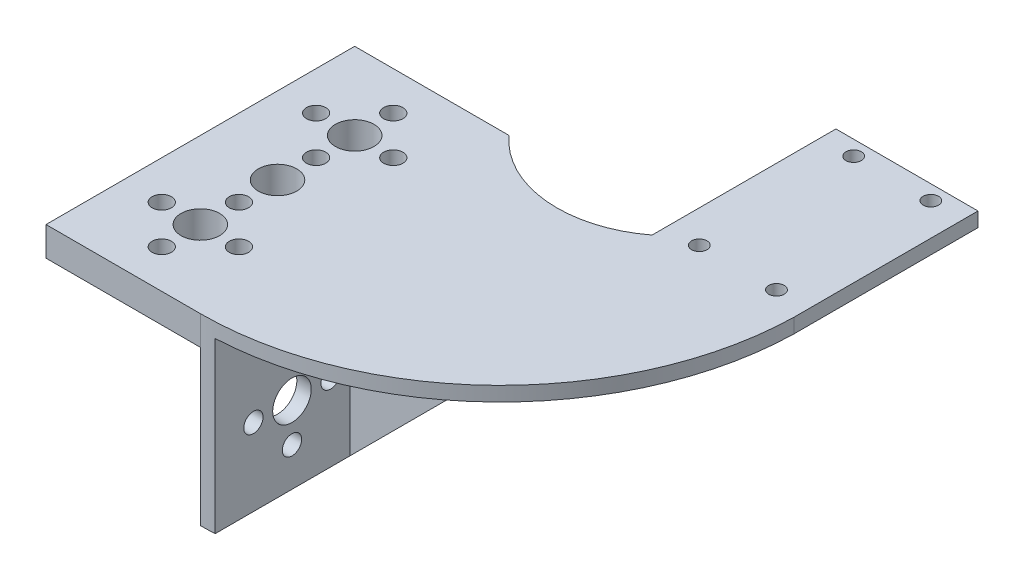
from build123d import *

# Parameters (mm, degrees)
SKETCH1_W           = 32
SKETCH1_H           = 64
SKETCH1_R           = 4
SKETCH1_R_2         = 2
SKETCH1_R_3         = 1.6
BOSS_EXTRUDE1_DEPTH = 3
BOSS_EXTRUDE2_START = -3.05
SKETCH1_5_W         = 32
SKETCH1_5_H         = 64
SKETCH1_5_R         = 4
SKETCH1_5_R_2       = 2
BOSS_EXTRUDE2_DEPTH = 3.05
SKETCH2_W           = 64
SKETCH2_H           = 35.05
SKETCH2_R           = 4
SKETCH2_R_2         = 2
BOSS_EXTRUDE3_DEPTH = 3
CUT_EXTRUDE1_START  = -38.05
CUT_EXTRUDE1_DEPTH  = 35.05
CUT_EXTRUDE2_START  = -38.05
CUT_EXTRUDE2_DEPTH  = 35.05
RIB1_REACH          = 110.796
SKETCH4_WALL_W      = 269.16074152
SKETCH4_WALL_H      = 8


# Read off the part's stored shape, not the designer's step: Cut-Extrude1, Cut-Extrude2
with BuildPart() as part:
    # Sketch1 → Boss-Extrude1 (new body)
    # profile 1 of 2: a face of its own
    with BuildSketch(Plane(origin=(0, 0, 0), x_dir=(1, 0, 0), z_dir=(0, 1, 0))):
        with Locations((0, -16)):
            Rectangle(SKETCH1_W, SKETCH1_H)
        with Locations(Location((0, -32, 0), (0, 0, 270))):
            Circle(SKETCH1_R, mode=Mode.SUBTRACT)
        with Locations(Location((0, -40, 0), (0, 0, 270))):
            Circle(SKETCH1_R_2, mode=Mode.SUBTRACT)
        with Locations(Location((0, 0, 0), (0, 0, 270))):
            Circle(SKETCH1_R, mode=Mode.SUBTRACT)
        with Locations(Location((0, 8, 0), (0, 0, 270))):
            Circle(SKETCH1_R_2, mode=Mode.SUBTRACT)
        with Locations(Location((0, -16, 0), (0, 0, 270))):
            Circle(SKETCH1_R, mode=Mode.SUBTRACT)
        with Locations(Location((8, 0, 0), (0, 0, 270))):
            Circle(SKETCH1_R_2, mode=Mode.SUBTRACT)
        with Locations(Location((0, -8, 0), (0, 0, 270))):
            Circle(SKETCH1_R_2, mode=Mode.SUBTRACT)
        with Locations(Location((-8, 0, 0), (0, 0, 270))):
            Circle(SKETCH1_R_2, mode=Mode.SUBTRACT)
        with Locations(Location((-8, -32, 0), (0, 0, 270))):
            Circle(SKETCH1_R_2, mode=Mode.SUBTRACT)
        with Locations(Location((8, -32, 0), (0, 0, 270))):
            Circle(SKETCH1_R_2, mode=Mode.SUBTRACT)
        with Locations(Location((0, -24, 0), (0, 0, 270))):
            Circle(SKETCH1_R_2, mode=Mode.SUBTRACT)
    # profile 2 of 2: a face of its own
    with BuildSketch(Plane(origin=(0, 0, 0), x_dir=(1, 0, 0), z_dir=(0, 1, 0))):
        with BuildLine():
            ThreePointArc((16, 16), (31.762527334, 8.054271284), (48.722, 12.95))
            Line((48.722, 12.95), (48.722, 51.05))
            Line((48.722, 51.05), (78.182, 51.05))
            Line((78.182, 51.05), (78.182, 12.95))
            ThreePointArc((78.182, 12.95), (59.535915128, -30.221467801), (16, -48))
            Line((16, -48), (16, 16))
        make_face()
        with Locations(Location((71.452, 16, 0), (0, 0, 270))):
            Circle(SKETCH1_R_3, mode=Mode.SUBTRACT)
        with Locations(Location((71.452, 48, 0), (0, 0, 270))):
            Circle(SKETCH1_R_3, mode=Mode.SUBTRACT)
        with Locations(Location((55.452, 48, 0), (0, 0, 270))):
            Circle(SKETCH1_R_3, mode=Mode.SUBTRACT)
        with Locations(Location((55.452, 16, 0), (0, 0, 270))):
            Circle(SKETCH1_R_3, mode=Mode.SUBTRACT)
    extrude(amount=BOSS_EXTRUDE1_DEPTH)

    # Sketch1<5> → Boss-Extrude2 (add)
    with BuildSketch(Plane(origin=(0, 0, 0), x_dir=(1, 0, 0), z_dir=(0, 1, 0)).offset(BOSS_EXTRUDE2_START)):
        with Locations((0, -16)):
            Rectangle(SKETCH1_5_W, SKETCH1_5_H)
        with Locations(Location((0, -32, 0), (0, 0, 270))):
            Circle(SKETCH1_5_R, mode=Mode.SUBTRACT)
        with Locations(Location((0, -40, 0), (0, 0, 270))):
            Circle(SKETCH1_5_R_2, mode=Mode.SUBTRACT)
        with Locations(Location((0, 0, 0), (0, 0, 270))):
            Circle(SKETCH1_5_R, mode=Mode.SUBTRACT)
        with Locations(Location((0, 8, 0), (0, 0, 270))):
            Circle(SKETCH1_5_R_2, mode=Mode.SUBTRACT)
        with Locations(Location((0, -16, 0), (0, 0, 270))):
            Circle(SKETCH1_5_R, mode=Mode.SUBTRACT)
        with Locations(Location((8, 0, 0), (0, 0, 270))):
            Circle(SKETCH1_5_R_2, mode=Mode.SUBTRACT)
        with Locations(Location((0, -8, 0), (0, 0, 270))):
            Circle(SKETCH1_5_R_2, mode=Mode.SUBTRACT)
        with Locations(Location((-8, 0, 0), (0, 0, 270))):
            Circle(SKETCH1_5_R_2, mode=Mode.SUBTRACT)
        with Locations(Location((-8, -32, 0), (0, 0, 270))):
            Circle(SKETCH1_5_R_2, mode=Mode.SUBTRACT)
        with Locations(Location((8, -32, 0), (0, 0, 270))):
            Circle(SKETCH1_5_R_2, mode=Mode.SUBTRACT)
        with Locations(Location((0, -24, 0), (0, 0, 270))):
            Circle(SKETCH1_5_R_2, mode=Mode.SUBTRACT)
    extrude(amount=BOSS_EXTRUDE2_DEPTH)

    # Sketch2 → Boss-Extrude3 (add)
    with BuildSketch(Plane(origin=(16, 0, 0), x_dir=(0, 0, -1), z_dir=(1, 0, 0))):
        with Locations((-16, -17.525)):
            Rectangle(SKETCH2_W, SKETCH2_H)
        with Locations((0, -19.05)):
            Circle(SKETCH2_R, mode=Mode.SUBTRACT)
        with Locations((8, -19.05)):
            Circle(SKETCH2_R_2, mode=Mode.SUBTRACT)
        with Locations((0, -27.05)):
            Circle(SKETCH2_R_2, mode=Mode.SUBTRACT)
        with Locations((-8, -19.05)):
            Circle(SKETCH2_R_2, mode=Mode.SUBTRACT)
        with Locations((0, -11.05)):
            Circle(SKETCH2_R_2, mode=Mode.SUBTRACT)
        with Locations(Location((-32, -27.05, 0), (0, 0, 180))):
            Circle(SKETCH2_R_2, mode=Mode.SUBTRACT)
        with Locations(Location((-40, -19.05, 0), (0, 0, 180))):
            Circle(SKETCH2_R_2, mode=Mode.SUBTRACT)
        with Locations(Location((-24, -19.05, 0), (0, 0, 180))):
            Circle(SKETCH2_R_2, mode=Mode.SUBTRACT)
        with Locations(Location((-32, -11.05, 0), (0, 0, 180))):
            Circle(SKETCH2_R_2, mode=Mode.SUBTRACT)
        with Locations(Location((-32, -19.05, 0), (0, 0, 180))):
            Circle(SKETCH2_R, mode=Mode.SUBTRACT)
    extrude(amount=BOSS_EXTRUDE3_DEPTH)

    # Cut-Extrude1 outline → Cut-Extrude1 (cut)
    with BuildSketch(Plane(origin=(0, 3, 0), x_dir=(1, 0, 0), z_dir=(0, 1, 0)).offset(CUT_EXTRUDE1_START)):
        with BuildLine():
            ThreePointArc((16, 16), (17.439637495, 14.523053201), (19, 13.174277157))
            Line((19, 13.174277157), (19, 16))
            Line((19, 16), (16, 16))
        make_face()
    extrude(amount=CUT_EXTRUDE1_DEPTH, mode=Mode.SUBTRACT)

    # Cut-Extrude2 outline → Cut-Extrude2 (cut)
    with BuildSketch(Plane(origin=(0, 3, 0), x_dir=(1, 0, 0), z_dir=(0, 1, 0)).offset(CUT_EXTRUDE2_START)):
        with BuildLine():
            Line((16, -48), (19, -48))
            Line((19, -48), (19, -47.927604143))
            ThreePointArc((19, -47.927604143), (17.5004367, -47.981898402), (16, -48))
        make_face()
    extrude(amount=CUT_EXTRUDE2_DEPTH, mode=Mode.SUBTRACT)

    # Sketch4 wall → Rib1 (add, up to next)
    with BuildSketch(Plane(origin=(36.525, -17.525, 16), x_dir=(0.707106781187, 0.707106781187, 0), z_dir=(-0.707106781187, 0.707106781187, 0)), mode=Mode.PRIVATE) as rib1_sk1:
        Rectangle(SKETCH4_WALL_W, SKETCH4_WALL_H)
    rib1_tool1 = extrude(rib1_sk1.sketch, amount=RIB1_REACH, mode=Mode.PRIVATE) - part.part
    add(rib1_tool1.solids().sort_by_distance((36.525, -17.525, 16))[0])


solid = part.part
